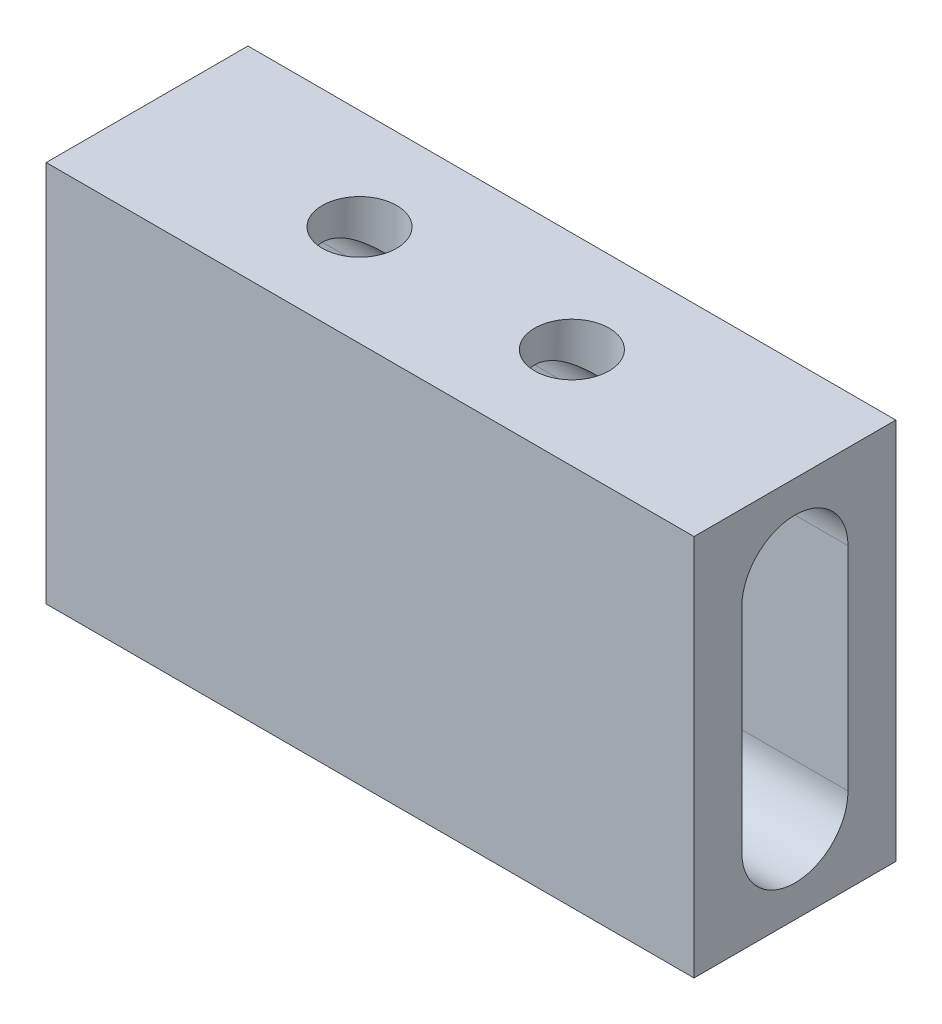
from build123d import *

# Parameters (mm, degrees)
SKETCH1_W           = 9.5
SKETCH1_H           = 18
BOSS_EXTRUDE1_DEPTH = 30.5
SKETCH2_R           = 1.75
CUT_EXTRUDE1_DEPTH  = 5


with BuildPart() as part:
    # Sketch1 → Boss-Extrude1 (new body)
    with BuildSketch(Plane(origin=(0, 0, 0), x_dir=(0, 0, -1), z_dir=(1, 0, 0))):
        with Locations((-10.245812999, 6.370752225)):
            Rectangle(SKETCH1_W, SKETCH1_H)
        with BuildLine():
            Line((-7.745812999, 11.370752225), (-7.745812999, 1.370752225))
            ThreePointArc((-7.745812999, 1.370752225), (-10.245812999, -1.129247775), (-12.745812999, 1.370752225))
            Line((-12.745812999, 1.370752225), (-12.745812999, 11.370752225))
            ThreePointArc((-12.745812999, 11.370752225), (-10.245812999, 13.870752225), (-7.745812999, 11.370752225))
        make_face(mode=Mode.SUBTRACT)
    extrude(amount=BOSS_EXTRUDE1_DEPTH)

    # Sketch2 → Cut-Extrude1 (cut)
    with BuildSketch(Plane(origin=(0, 15.370752225, 0), x_dir=(1, 0, 0), z_dir=(0, 1, 0))):
        with Locations((-10, -10.245812999)):
            Circle(SKETCH2_R)
        with Locations((-20, -10.245812999)):
            Circle(SKETCH2_R)
        with Locations((10, -10.245812999)):
            Circle(SKETCH2_R)
        with Locations((20, -10.245812999)):
            Circle(SKETCH2_R)
    extrude(amount=-CUT_EXTRUDE1_DEPTH, mode=Mode.SUBTRACT)


solid = part.part
